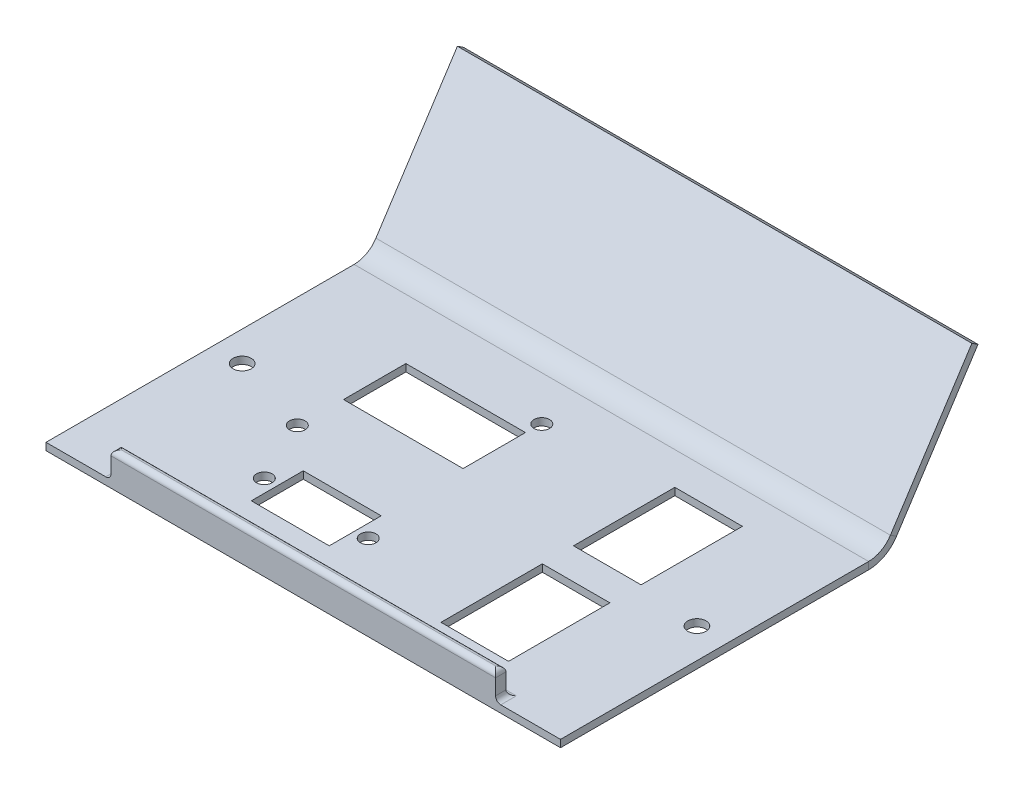
from build123d import *

# Parameters (mm, degrees)
T_LE_DE_BASE_PLI_E1_DEPTH = 49.5
ESQUISSE6_R               = 1.75
ENL_V_MAT_EXTRU_1_DEPTH   = 99.371997957
ESQUISSE7_R               = 1.5
ESQUISSE7_W               = 13
ESQUISSE7_H               = 19.5
ESQUISSE7_W_2             = 23
ESQUISSE7_H_2             = 12
ESQUISSE7_W_3             = 15
ESQUISSE7_H_3             = 10
ENL_V_MAT_EXTRU_2_DEPTH   = 1.4
ESQUISSE11_W              = 74
ESQUISSE11_H              = 2
BOSS_EXTRU_2_DEPTH        = 5
CONG_1_R                  = 1


# Sheet-metal steps are written as plain solids
with BuildPart() as part:
    # Esquisse1 → Tôle de base pliée1 (new, symmetric)
    with BuildSketch(Plane(origin=(0, 0, 0), x_dir=(0, 0, -1), z_dir=(1, 0, 0))):
        with BuildLine():
            Line((0, 0), (59.285221502, 0))
            ThreePointArc((59.285221502, 0), (61.671015303, 0.605914437), (63.478574342, 2.276804825))
            Line((63.478574342, 2.276804825), (79.156129603, 26.41812289))
            Line((79.156129603, 26.41812289), (80.330268398, 25.655628241))
            Line((80.330268398, 25.655628241), (64.652713137, 1.514310176))
            ThreePointArc((64.652713137, 1.514310176), (62.339037567, -0.624429521), (59.285221502, -1.4))
            Line((59.285221502, -1.4), (0, -1.4))
            Line((0, -1.4), (0, 0))
        make_face()
    extrude(amount=T_LE_DE_BASE_PLI_E1_DEPTH, both=True)

    # Esquisse6 → Enlèv. mat.-Extru.1 (cut, through all)
    with BuildSketch(Plane.XZ.offset(1.4)):
        with Locations(Location((-43.75, -32, 0), (0, 0, 270))):
            Circle(ESQUISSE6_R)
        with Locations(Location((43.75, -32, 0), (0, 0, 90))):
            Circle(ESQUISSE6_R)
    extrude(amount=-ENL_V_MAT_EXTRU_1_DEPTH, mode=Mode.SUBTRACT)

    # Esquisse7 → Enlèv. mat.-Extru.2 (cut)
    with BuildSketch(Plane.XZ.offset(1.4)):
        with Locations(Location((-28.15, -27, 0), (0, 0, 270))):
            Circle(ESQUISSE7_R)
        with Locations(Location((-4.85, -50.75, 0), (0, 0, 270))):
            Circle(ESQUISSE7_R)
        with Locations(Location((-2.5, -15, 0), (0, 0, 270))):
            Circle(ESQUISSE7_R)
        with Locations(Location((-22.5, -15, 0), (0, 0, 90))):
            Circle(ESQUISSE7_R)
        with Locations((25, -17.75)):
            Rectangle(ESQUISSE7_W, ESQUISSE7_H)
        with Locations((-16.5, -41.75)):
            Rectangle(ESQUISSE7_W_2, ESQUISSE7_H_2)
        with Locations((25, -43.25)):
            Rectangle(ESQUISSE7_W, ESQUISSE7_H)
        with Locations((-12.5, -15)):
            Rectangle(ESQUISSE7_W_3, ESQUISSE7_H_3)
    extrude(amount=-ENL_V_MAT_EXTRU_2_DEPTH, mode=Mode.SUBTRACT)

    # Esquisse11 → Boss.-Extru.2 (add)
    with BuildSketch(Plane(origin=(0, 0, 0), x_dir=(1, 0, 0), z_dir=(0, 1, 0))):
        with Locations((0, 1)):
            Rectangle(ESQUISSE11_W, ESQUISSE11_H)
    extrude(amount=BOSS_EXTRU_2_DEPTH)

    # Congé1
    cong_1_edges = [part.edges().sort_by_distance(p)[0] for p in [
        (-37, 0, -1),
        (37, 0, -1),
        (0, 0, -2),
        (-37, 5, -1),
        (0, 5, 0),
        (37, 5, -1),
        (0, 5, -2),
    ]]
    fillet(cong_1_edges, radius=CONG_1_R - 0.0001)  # a hair under: the kernel refuses the full size


solid = part.part
